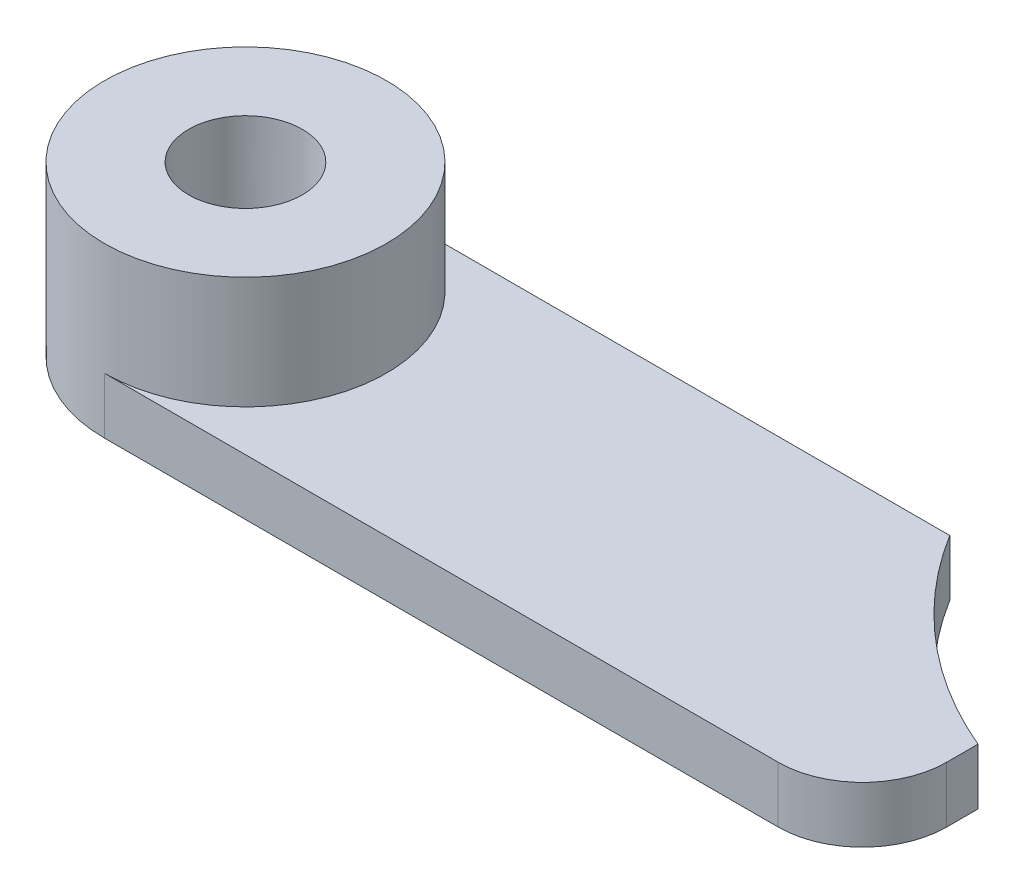
from build123d import *

# Parameters (mm, degrees)
SKETCH1_R           = 5.025
SKETCH1_R_2         = 2.025
BOSS_EXTRUDE1_DEPTH = 6
SKETCH2_W           = 27
SKETCH2_H           = 10.05
BOSS_EXTRUDE2_DEPTH = 2
SKETCH3_R           = 15
CUT_EXTRUDE1_DEPTH  = 2
FILLET1_R           = 3


with BuildPart() as part:
    # Sketch1 → Boss-Extrude1 (new body)
    with BuildSketch(Plane(origin=(0, 0, 0), x_dir=(1, 0, 0), z_dir=(0, 1, 0))):
        Circle(SKETCH1_R)
        Circle(SKETCH1_R_2, mode=Mode.SUBTRACT)
    extrude(amount=BOSS_EXTRUDE1_DEPTH)

    # Sketch2 → Boss-Extrude2 (add)
    with BuildSketch(Plane.XZ):
        with Locations((13.5, 0)):
            Rectangle(SKETCH2_W, SKETCH2_H)
    extrude(amount=-BOSS_EXTRUDE2_DEPTH)

    # Sketch3 → Cut-Extrude1 (cut)
    with BuildSketch(Plane(origin=(0, 2, 0), x_dir=(1, 0, 0), z_dir=(0, 1, 0))):
        with Locations((32.816228029, 12.917418084)):
            Circle(SKETCH3_R)
    extrude(amount=-CUT_EXTRUDE1_DEPTH, mode=Mode.SUBTRACT)

    # Fillet1
    fillet1_edges = [part.edges().sort_by_distance(p)[0] for p in [
        (27, 1, 5.025),
    ]]
    fillet(fillet1_edges, radius=FILLET1_R)


solid = part.part
